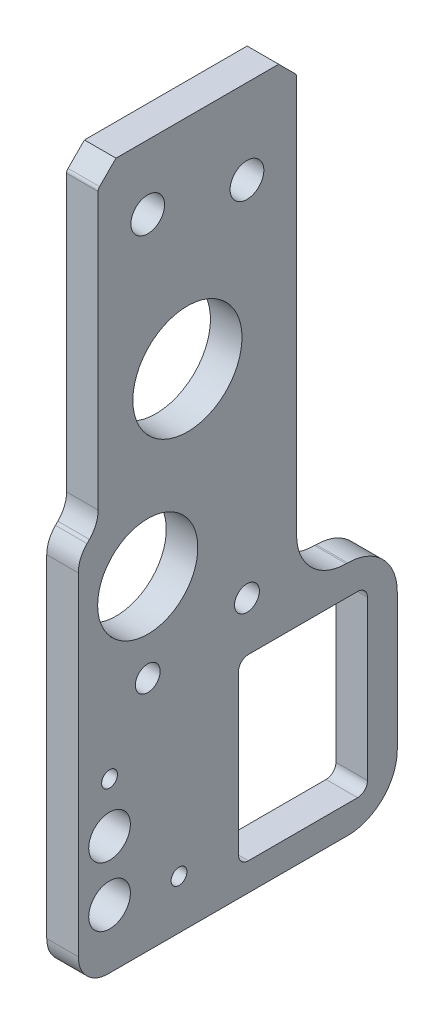
from build123d import *

# Parameters (mm, degrees)
SKETCH1_R             = 5.05
SKETCH1_R_2           = 1.7
SKETCH1_R_3           = 2.1
SKETCH1_R_4           = 0.8
SKETCH1_W             = 13
SKETCH1_H             = 18
BOSS_EXTRUDE1_DEPTH   = 3.18
SKETCH3_R             = 5.5
CUT_EXTRUDE4_DEPTH    = 78.831812262
FILLET2_R             = 3
CHAMFER2_SIZE         = 1.8
FILLET4_R             = 0.5
M2X0_4_TAPPED_HOLE1_D = 1.6
FILLET9_R             = 1
FILLET11_R            = 5
M3X0_5_TAPPED_HOLE1_D = 2.5


with BuildPart() as part:
    # Sketch1 → Boss-Extrude1 (new body)
    with BuildSketch(Plane(origin=(0, 0, 0), x_dir=(0, 0, -1), z_dir=(1, 0, 0))):
        Polygon((0, 0), (0, 37.75), (2, 39.75), (2, 70.81), (22, 70.81), (22, 23.81), (32.15, 23.81), (32.15, 0), align=None)
        with Locations((7, 32.7)):
            Circle(SKETCH1_R, mode=Mode.SUBTRACT)
        with Locations((7, 64.31)):
            Circle(SKETCH1_R_2, mode=Mode.SUBTRACT)
        with Locations((17, 62.31)):
            Circle(SKETCH1_R_2, mode=Mode.SUBTRACT)
        with Locations((3.15, 5.95)):
            Circle(SKETCH1_R_3, mode=Mode.SUBTRACT)
        with Locations((3.15, 11.95)):
            Circle(SKETCH1_R_3, mode=Mode.SUBTRACT)
        with Locations((10.15, 4.95)):
            Circle(SKETCH1_R_4, mode=Mode.SUBTRACT)
        with Locations((3.15, 16.95)):
            Circle(SKETCH1_R_4, mode=Mode.SUBTRACT)
        with Locations((22.65, 11.81)):
            Rectangle(SKETCH1_W, SKETCH1_H, mode=Mode.SUBTRACT)
    extrude(amount=BOSS_EXTRUDE1_DEPTH)

    # Sketch3 → Cut-Extrude4 (cut, through all)
    with BuildSketch(Plane.ZY):
        with Locations((-11, 48.810865899)):
            Circle(SKETCH3_R)
    extrude(amount=-CUT_EXTRUDE4_DEPTH, mode=Mode.SUBTRACT)

    # Fillet2
    fillet2_edges = [part.edges().sort_by_distance(p)[0] for p in [
        (1.59, 37.75, 0),
        (1.59, 39.75, -2),
        (1.59, 0, 0),
    ]]
    fillet(fillet2_edges, radius=FILLET2_R)

    # Chamfer2
    chamfer2_edges = [part.edges().sort_by_distance(p)[0] for p in [
        (1.59, 70.81, -22),
        (1.59, 70.81, -2),
    ]]
    chamfer(chamfer2_edges, length=CHAMFER2_SIZE)

    # Fillet4
    fillet4_edges = [part.edges().sort_by_distance(p)[0] for p in [
        (1.59, 69.01, -2),
        (1.59, 69.01, -22),
    ]]
    fillet(fillet4_edges, radius=FILLET4_R)

    # M2x0.4 Tapped Hole1 (through all)
    with Locations(Plane(origin=(0, 16.95, -3.15), x_dir=(0, 0, -1), z_dir=(-1, 0, 0))):
        with Locations((0, 0), (7, 12)):
            Hole(M2X0_4_TAPPED_HOLE1_D / 2)

    # Fillet9
    fillet9_edges = [part.edges().sort_by_distance(p)[0] for p in [
        (1.59, 2.81, -29.15),
        (1.59, 2.81, -16.15),
        (1.59, 20.81, -29.15),
        (1.59, 20.81, -16.15),
    ]]
    fillet(fillet9_edges, radius=FILLET9_R)

    # Fillet11
    fillet11_edges = [part.edges().sort_by_distance(p)[0] for p in [
        (1.59, 0, -32.15),
        (1.59, 23.81, -22),
        (1.59, 23.81, -32.15),
    ]]
    fillet(fillet11_edges, radius=FILLET11_R)

    # M3x0.5 Tapped Hole1 (through all)
    with Locations(Plane(origin=(3.18, 0, 0), x_dir=(0, 0, -1), z_dir=(1, 0, 0))):
        with Locations((7, 23.81), (17, 25.81)):
            Hole(M3X0_5_TAPPED_HOLE1_D / 2)


solid = part.part
